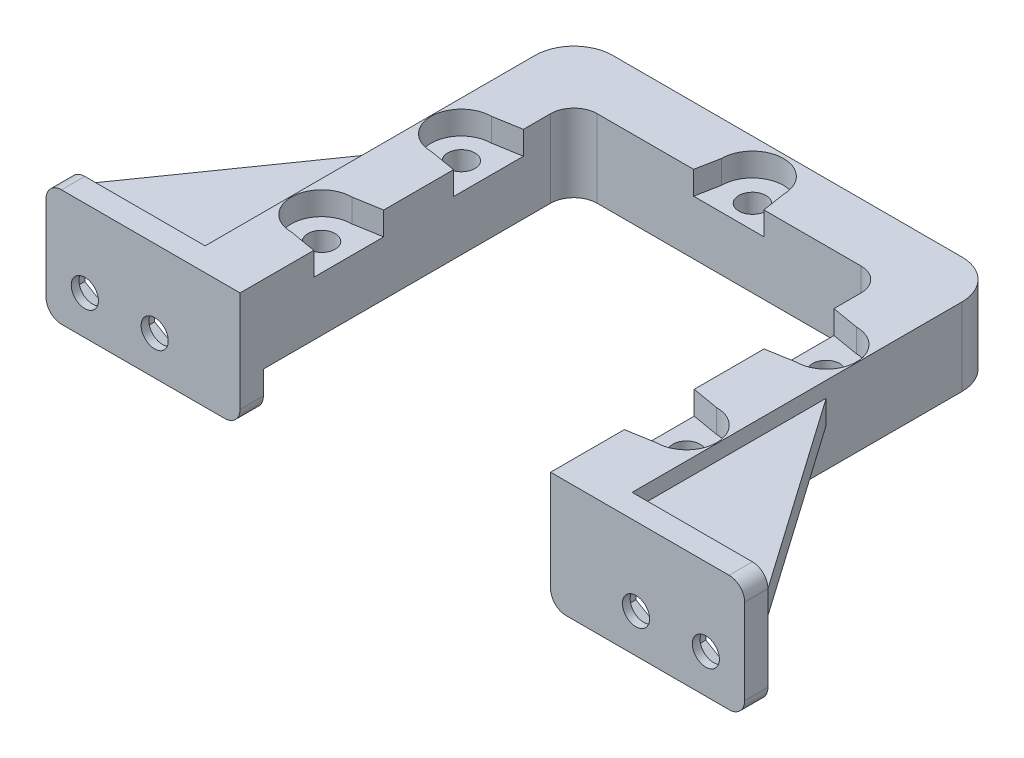
from build123d import *

# Parameters (mm, degrees)
BOSS_EXTRUDE1_DEPTH  = 10
SKETCH2_R            = 1.75
CUT_EXTRUDE1_DEPTH   = 15.5
CUT_EXTRUDE2_DEPTH   = 3
CUT_EXTRUDE7_DEPTH   = 3
SKETCH9_W            = 25
SKETCH9_H            = 15
BOSS_EXTRUDE2_DEPTH  = 3
SKETCH11_W           = 17.5
SKETCH11_H           = 3
BOSS_EXTRUDE4_DEPTH  = 25
CUT_EXTRUDE9_DEPTH   = 25
FILLET2_R            = 2
SKETCH14_R           = 1.75
CUT_EXTRUDE10_DEPTH  = 67.191011474
CUT_EXTRUDE11_DEPTH  = 2
FILLET2_OF_MIRROR1_R = 2


with BuildPart() as part:
    # Sketch1 → Boss-Extrude1 (new body)
    with BuildSketch(Plane(origin=(0, 0, 0), x_dir=(1, 0, 0), z_dir=(0, 1, 0))):
        with BuildLine():
            Line((-20, -20), (-27.5, -20))
            Line((-27.5, -20), (-27.5, 22.5))
            ThreePointArc((-27.5, 22.5), (-26.035533906, 26.035533906), (-22.5, 27.5))
            Line((-22.5, 27.5), (22.5, 27.5))
            ThreePointArc((22.5, 27.5), (26.035533906, 26.035533906), (27.5, 22.5))
            Line((27.5, 22.5), (27.5, -20))
            Line((27.5, -20), (20, -20))
            Line((20, -20), (20, 17))
            ThreePointArc((20, 17), (19.121320344, 19.121320344), (17, 20))
            Line((17, 20), (-17, 20))
            ThreePointArc((-17, 20), (-19.121320344, 19.121320344), (-20, 17))
            Line((-20, 17), (-20, -20))
        make_face()
    extrude(amount=BOSS_EXTRUDE1_DEPTH)

    # Sketch2 → Cut-Extrude1 (cut)
    with BuildSketch(Plane(origin=(0, 10, 0), x_dir=(1, 0, 0), z_dir=(0, 1, 0))):
        with Locations((-23.5, -9)):
            Circle(SKETCH2_R)
        with Locations((23.5, -9)):
            Circle(SKETCH2_R)
        with Locations((0, 23)):
            Circle(SKETCH2_R)
        with Locations((-23.5, 9)):
            Circle(SKETCH2_R)
        with Locations((23.5, 9)):
            Circle(SKETCH2_R)
    extrude(amount=-CUT_EXTRUDE1_DEPTH, mode=Mode.SUBTRACT)

    # Sketch3 → Cut-Extrude2 (cut)
    with BuildSketch(Plane.XZ):
        Polygon((-20.6, 7.325684219), (-20.6, 10.674315781), (-23.5, 12.348631561), (-26.4, 10.674315781), (-26.4, 7.325684219), (-23.5, 5.651368439), align=None)
        Polygon((23.4996681, 5.651368455), (26.399834036, 7.325396794), (26.400165936, 10.674028339), (23.5003319, 12.348631545), (20.600165964, 10.674603206), (20.599834064, 7.325971661), align=None)
        Polygon((3.348631561, -23), (1.674315781, -20.1), (-1.674315781, -20.1), (-3.348631561, -23), (-1.674315781, -25.9), (1.674315781, -25.9), align=None)
        Polygon((-23.4996681, -5.651368455), (-26.399834036, -7.325396794), (-26.400165936, -10.674028339), (-23.5003319, -12.348631545), (-20.600165964, -10.674603206), (-20.599834064, -7.325971661), align=None)
        Polygon((23.4996681, -5.651368455), (20.599834064, -7.325971661), (20.600165964, -10.674603206), (23.5003319, -12.348631545), (26.400165936, -10.674028339), (26.399834036, -7.325396794), align=None)
    extrude(amount=-CUT_EXTRUDE2_DEPTH, mode=Mode.SUBTRACT)

    # Sketch8 → Cut-Extrude7 (cut)
    with BuildSketch(Plane(origin=(0, 10, 0), x_dir=(1, 0, 0), z_dir=(0, 1, 0))):
        with BuildLine():
            Line((-4, 23), (-4.57455059, 20))
            Line((-4.57455059, 20), (4.478329848, 20))
            Line((4.478329848, 20), (4, 23))
            ThreePointArc((4, 23), (0, 27), (-4, 23))
        make_face()
        with BuildLine():
            Line((23.5, 12.9), (20, 13.5))
            Line((20, 13.5), (20, 4.5))
            Line((20, 4.5), (23.5, 5.1))
            ThreePointArc((23.5, 5.1), (27.4, 9), (23.5, 12.9))
        make_face()
        with BuildLine():
            Line((23.5, -5.1), (20, -4.5))
            Line((20, -4.5), (20, -13.5))
            Line((20, -13.5), (23.5, -12.9))
            ThreePointArc((23.5, -12.9), (27.4, -9), (23.5, -5.1))
        make_face()
        with BuildLine():
            Line((-23.5, -12.9), (-20, -13.5))
            Line((-20, -13.5), (-20, -4.5))
            Line((-20, -4.5), (-23.5, -5.1))
            ThreePointArc((-23.5, -5.1), (-27.4, -9), (-23.5, -12.9))
        make_face()
        with BuildLine():
            Line((-23.5, 12.9), (-20, 13.5))
            Line((-20, 13.5), (-20, 4.5))
            Line((-20, 4.5), (-23.5, 5.1))
            ThreePointArc((-23.5, 5.1), (-27.4, 9), (-23.5, 12.9))
        make_face()
    extrude(amount=-CUT_EXTRUDE7_DEPTH, mode=Mode.SUBTRACT)

    # Sketch9 → Boss-Extrude2 (add)
    with BuildSketch(Plane.XY.offset(20)):
        with Locations((-32.5, 2.5)):
            Rectangle(SKETCH9_W, SKETCH9_H)
    boss_extrude2 = extrude(amount=BOSS_EXTRUDE2_DEPTH)

    # Sketch11 → Boss-Extrude4 (add)
    with BuildSketch(Plane(origin=(0, 0, 20), x_dir=(-1, 0, 0), z_dir=(0, 0, -1))):
        with Locations((36.25, 6.5)):
            Rectangle(SKETCH11_W, SKETCH11_H)
    boss_extrude4 = extrude(amount=BOSS_EXTRUDE4_DEPTH)

    # Sketch13 → Cut-Extrude9 (cut)
    with BuildSketch(Plane.XZ.offset(-5)):
        Polygon((-45, 20), (-27.5, -5), (-45, -5), align=None)
    cut_extrude9 = extrude(amount=-CUT_EXTRUDE9_DEPTH, mode=Mode.SUBTRACT)

    # Fillet2
    fillet2_edges = [part.edges().sort_by_distance(p)[0] for p in [
        (-20, -5, 21.5),
        (-45, 10, 21.5),
        (-45, -5, 21.5),
    ]]
    fillet(fillet2_edges, radius=FILLET2_R)

    # Sketch14 → Cut-Extrude10 (cut, through all)
    with BuildSketch(Plane(origin=(0, 0, 20), x_dir=(-1, 0, 0), z_dir=(0, 0, -1))):
        with Locations((40, 0)):
            Circle(SKETCH14_R)
        with Locations((31, 0)):
            Circle(SKETCH14_R)
    cut_extrude10 = extrude(amount=-CUT_EXTRUDE10_DEPTH, mode=Mode.SUBTRACT)

    # Sketch15 → Cut-Extrude11 (cut)
    with BuildSketch(Plane(origin=(0, 0, 20), x_dir=(-1, 0, 0), z_dir=(0, 0, -1))):
        Polygon((31, 3.464101615), (28, 1.732050808), (28, -1.732050808), (31, -3.464101615), (34, -1.732050808), (34, 1.732050808), align=None)
        Polygon((40, 3.464101615), (37, 1.732050808), (37, -1.732050808), (40, -3.464101615), (43, -1.732050808), (43, 1.732050808), align=None)
    cut_extrude11 = extrude(amount=-CUT_EXTRUDE11_DEPTH, mode=Mode.SUBTRACT)

    # Mirror1: Boss-Extrude2, Boss-Extrude4, Cut-Extrude9, Cut-Extrude10, Cut-Extrude11 across plane
    add(boss_extrude2.mirror(Plane(origin=(0, 0, 0), x_dir=(0, 0, 1), z_dir=(1, 0, 0))))
    add(boss_extrude4.mirror(Plane(origin=(0, 0, 0), x_dir=(0, 0, 1), z_dir=(1, 0, 0))))
    add(cut_extrude9.mirror(Plane(origin=(0, 0, 0), x_dir=(0, 0, 1), z_dir=(1, 0, 0))), mode=Mode.SUBTRACT)
    add(cut_extrude10.mirror(Plane(origin=(0, 0, 0), x_dir=(0, 0, 1), z_dir=(1, 0, 0))), mode=Mode.SUBTRACT)
    add(cut_extrude11.mirror(Plane(origin=(0, 0, 0), x_dir=(0, 0, 1), z_dir=(1, 0, 0))), mode=Mode.SUBTRACT)

    # Fillet2 of Mirror1
    fillet2_of_mirror1_edges = [part.edges().sort_by_distance(p)[0] for p in [
        (20, -5, 21.5),
        (45, 10, 21.5),
        (45, -5, 21.5),
    ]]
    fillet(fillet2_of_mirror1_edges, radius=FILLET2_OF_MIRROR1_R)


solid = part.part
